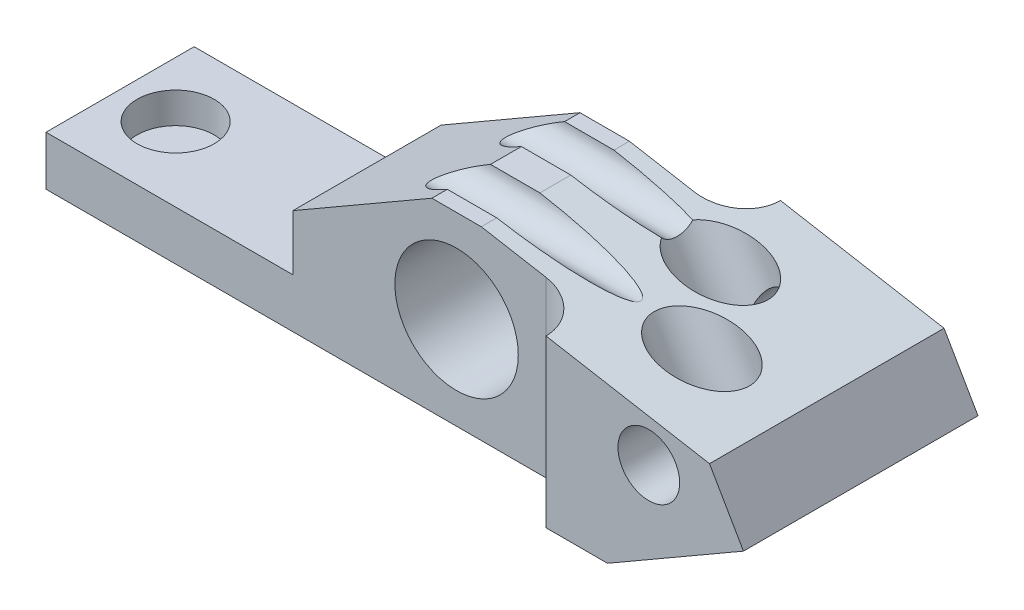
from build123d import *

# Parameters (mm, degrees)
SKETCH1_R               = 10
SKETCH1_W               = 40
SKETCH1_H               = 8
BOSS_EXTRUDE1_DEPTH     = 12
BOSS_EXTRUDE2_DEPTH     = 19
CUT_EXTRUDE1_DEPTH      = 38
CUT_EXTRUDE1_DEPTH_BACK = 38
SKETCH4_R               = 6
FILLET1_R               = 7
SKETCH6_R               = 6.25
CUT_EXTRUDE2_DEPTH      = 5
CUT_EXTRUDE3_DEPTH      = 56
CUT_EXTRUDE3_DEPTH_BACK = 21
SKETCH9_R               = 5
CUT_EXTRUDE4_DEPTH      = 14
SKETCH10_R              = 5
CUT_EXTRUDE5_DEPTH      = 11


with BuildPart() as part:
    # Sketch1 → Boss-Extrude1 (new, symmetric)
    # profile 1 of 2: a face of its own
    with BuildSketch(Plane.XY):
        Polygon((49.483339502, 12.718271103), (43.983339502, 22.244550544), (0, 30), (-8, 30), (-30.516660498, 17), (-30.516660498, 8), (-30.516660498, 0), (0, 0), (27.454647768, 0), align=None)
        with Locations((-4, 15)):
            Circle(SKETCH1_R, mode=Mode.SUBTRACT)
    # profile 2 of 2: a face of its own
    with BuildSketch(Plane.XY):
        with Locations((-50.516660498, 4)):
            Rectangle(SKETCH1_W, SKETCH1_H)
    extrude(amount=BOSS_EXTRUDE1_DEPTH, both=True)

    # Sketch2 → Boss-Extrude2 (add, symmetric)
    with BuildSketch(Plane.XY):
        Polygon((17.483339502, 26.917215533), (17.483339502, 0), (27.454647768, 0), (49.483339502, 12.718271103), (43.983339502, 22.244550544), align=None)
    extrude(amount=BOSS_EXTRUDE2_DEPTH, both=True)

    # Sketch4 → Cut-Extrude1 (cut, two sides: drawn at the far end of the back side and taken through both)
    with BuildSketch(Plane(origin=(1.363661942, -2.361931768, 0), x_dir=(-0.8660254037844379, -0.5000000000000014, 0), z_dir=(0.5000000000000014, -0.8660254037844379, 0)).offset(-CUT_EXTRUDE1_DEPTH_BACK)):
        with Locations((-31.137235053, 6)):
            Circle(SKETCH4_R)
        with Locations((-38.137235053, -6)):
            Circle(SKETCH4_R)
    extrude(amount=CUT_EXTRUDE1_DEPTH + CUT_EXTRUDE1_DEPTH_BACK, mode=Mode.SUBTRACT)

    # Fillet1
    fillet1_edges = [part.edges().sort_by_distance(p)[0] for p in [
        (17.483339502, 13.458607766, -12),
        (17.483339502, 13.458607766, 12),
    ]]
    fillet(fillet1_edges, radius=FILLET1_R - 0.0001)  # a hair under: the kernel refuses the full size

    # Sketch6 → Cut-Extrude2 (cut)
    with BuildSketch(Plane(origin=(0, 8, 0), x_dir=(1, 0, 0), z_dir=(0, 1, 0))):
        with Locations(Location((-61.516660498, 0, 0), (0, 0, 180))):
            Circle(SKETCH6_R)
    extrude(amount=-CUT_EXTRUDE2_DEPTH, mode=Mode.SUBTRACT)

    # Sketch8 → Cut-Extrude3 (cut, two sides: drawn at the far end of the back side and taken through both)
    with BuildSketch(Plane(origin=(0, 0, 0), x_dir=(0, 0, -1), z_dir=(1, 0, 0)).offset(-CUT_EXTRUDE3_DEPTH_BACK)):
        with BuildLine():
            Line((-9.5, 30), (-2.5, 30))
            ThreePointArc((-2.5, 30), (-6, 26.5), (-9.5, 30))
        make_face()
        with BuildLine():
            Line((2.5, 30), (9.5, 30))
            ThreePointArc((9.5, 30), (6, 26.5), (2.5, 30))
        make_face()
    extrude(amount=CUT_EXTRUDE3_DEPTH + CUT_EXTRUDE3_DEPTH_BACK, mode=Mode.SUBTRACT)

    # Sketch9 → Cut-Extrude4 (cut)
    with BuildSketch(Plane.XY.offset(19)):
        with Locations((34.148109615, 17.12820927)):
            Circle(SKETCH9_R)
    extrude(amount=-CUT_EXTRUDE4_DEPTH, mode=Mode.SUBTRACT)

    # Sketch10 → Cut-Extrude5 (cut)
    with BuildSketch(Plane(origin=(0, 0, -19), x_dir=(-1, 0, 0), z_dir=(0, 0, -1))):
        with Locations((-26.120496882, 17.032442386)):
            Circle(SKETCH10_R)
    extrude(amount=-CUT_EXTRUDE5_DEPTH, mode=Mode.SUBTRACT)


solid = part.part
